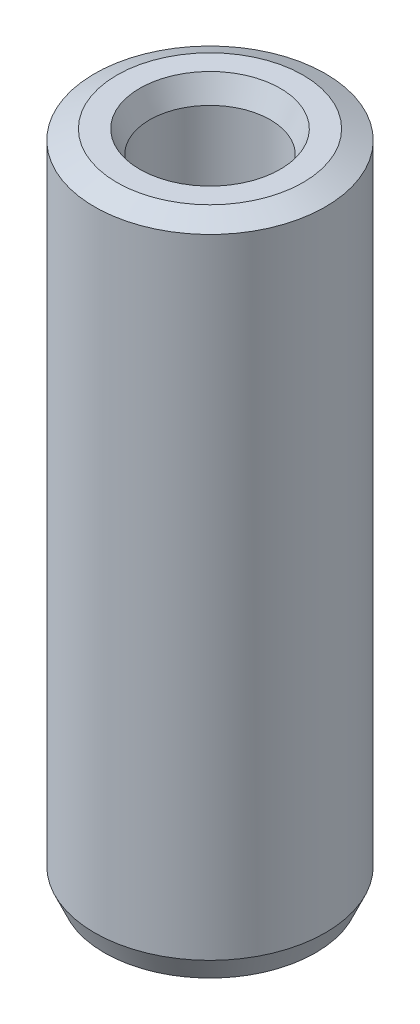
from build123d import *
from OCP.BRepFilletAPI import BRepFilletAPI_MakeChamfer

# Parameters (mm, degrees)
SKETCH1_R           = 7.5
BOSS_EXTRUDE1_DEPTH = 42.94357662
SKETCH2_R           = 3.920624087
CUT_EXTRUDE1_DEPTH  = 45.234045405
CHAMFER1_SIZE       = 0.64375174
CHAMFER1_SIZE2      = 1.452160162


with BuildPart() as part:
    # Sketch1 → Boss-Extrude1 (new body)
    with BuildSketch(Plane(origin=(0, 0, 0), x_dir=(1, 0, 0), z_dir=(0, 1, 0))):
        Circle(SKETCH1_R)
    extrude(amount=BOSS_EXTRUDE1_DEPTH)

    # Sketch2 → Cut-Extrude1 (cut, through all)
    with BuildSketch(Plane(origin=(0, 0, 0), x_dir=(1, 0, 0), z_dir=(0, 1, 0))):
        Circle(SKETCH2_R)
    extrude(amount=CUT_EXTRUDE1_DEPTH, mode=Mode.SUBTRACT)

    # Chamfer1: one chamfer whose edges measure the first distance from different faces: ONE call of the kernel's chamfer builder (chamfer() names one face for all edges)
    chamfer1_edges_1 = [part.edges().sort_by_distance(p)[0] for p in [
        (-3.920624087, 42.94357662, 0),
    ]]
    chamfer1_side_1 = [part.faces().sort_by_distance(p)[0] for p in [
        (-7.287867966, 42.94357662, 0),
    ]]
    chamfer1_edges_2 = [part.edges().sort_by_distance(p)[0] for p in [
        (-3.920624087, 0, 0),
    ]]
    chamfer1_side_2 = [part.faces().sort_by_distance(p)[0] for p in [
        (-3.920624087, 21.47178831, 0),
    ]]
    chamfer1_edges_3 = [part.edges().sort_by_distance(p)[0] for p in [
        (-7.5, 0, 0),
    ]]
    chamfer1_side_3 = [part.faces().sort_by_distance(p)[0] for p in [
        (-7.287867966, 0, 0),
    ]]
    chamfer1_edges_4 = [part.edges().sort_by_distance(p)[0] for p in [
        (-7.5, 42.94357662, 0),
    ]]
    chamfer1_side_4 = [part.faces().sort_by_distance(p)[0] for p in [
        (-7.5, 21.47178831, 0),
    ]]
    chamfer1 = BRepFilletAPI_MakeChamfer(part.part.solid().wrapped)
    for e in chamfer1_edges_1:
        chamfer1.Add(CHAMFER1_SIZE, CHAMFER1_SIZE2, e.wrapped, chamfer1_side_1[0].wrapped)  # the first distance lies on this face
    for e in chamfer1_edges_2:
        chamfer1.Add(CHAMFER1_SIZE, CHAMFER1_SIZE2, e.wrapped, chamfer1_side_2[0].wrapped)  # the first distance lies on this face
    for e in chamfer1_edges_3:
        chamfer1.Add(CHAMFER1_SIZE, CHAMFER1_SIZE2, e.wrapped, chamfer1_side_3[0].wrapped)  # the first distance lies on this face
    for e in chamfer1_edges_4:
        chamfer1.Add(CHAMFER1_SIZE, CHAMFER1_SIZE2, e.wrapped, chamfer1_side_4[0].wrapped)  # the first distance lies on this face
    add(Compound.cast(chamfer1.Shape()), mode=Mode.REPLACE)


solid = part.part
